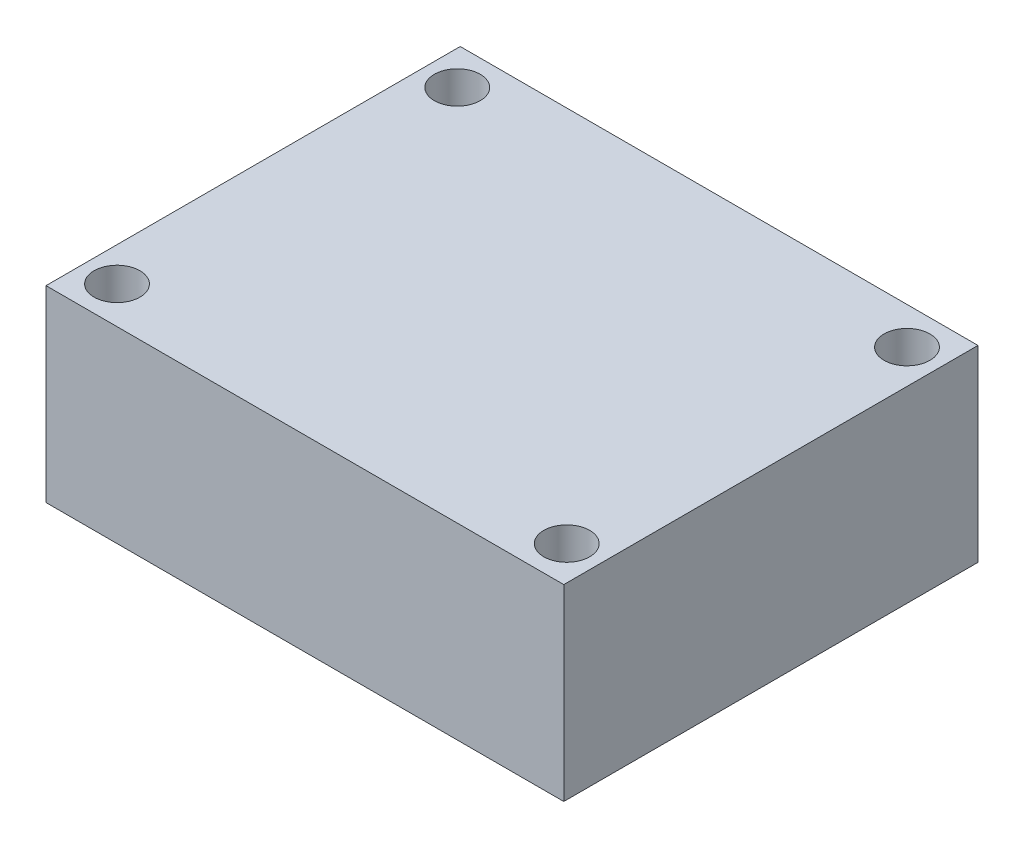
from build123d import *

# Parameters (mm, degrees)
SKETCH1_W           = 35
SKETCH1_H           = 28
SKETCH1_R           = 1.55
BOSS_EXTRUDE1_DEPTH = 12.7


with BuildPart() as part:
    # Sketch1 → Boss-Extrude1 (new body)
    with BuildSketch(Plane(origin=(0, 0, 0), x_dir=(1, 0, 0), z_dir=(0, 1, 0))):
        Rectangle(SKETCH1_W, SKETCH1_H)
        with Locations((-15.2, 11.5)):
            Circle(SKETCH1_R, mode=Mode.SUBTRACT)
        with Locations((15.2, 11.5)):
            Circle(SKETCH1_R, mode=Mode.SUBTRACT)
        with Locations((-15.2, -11.5)):
            Circle(SKETCH1_R, mode=Mode.SUBTRACT)
        with Locations((15.2, -11.5)):
            Circle(SKETCH1_R, mode=Mode.SUBTRACT)
    extrude(amount=BOSS_EXTRUDE1_DEPTH)


solid = part.part
